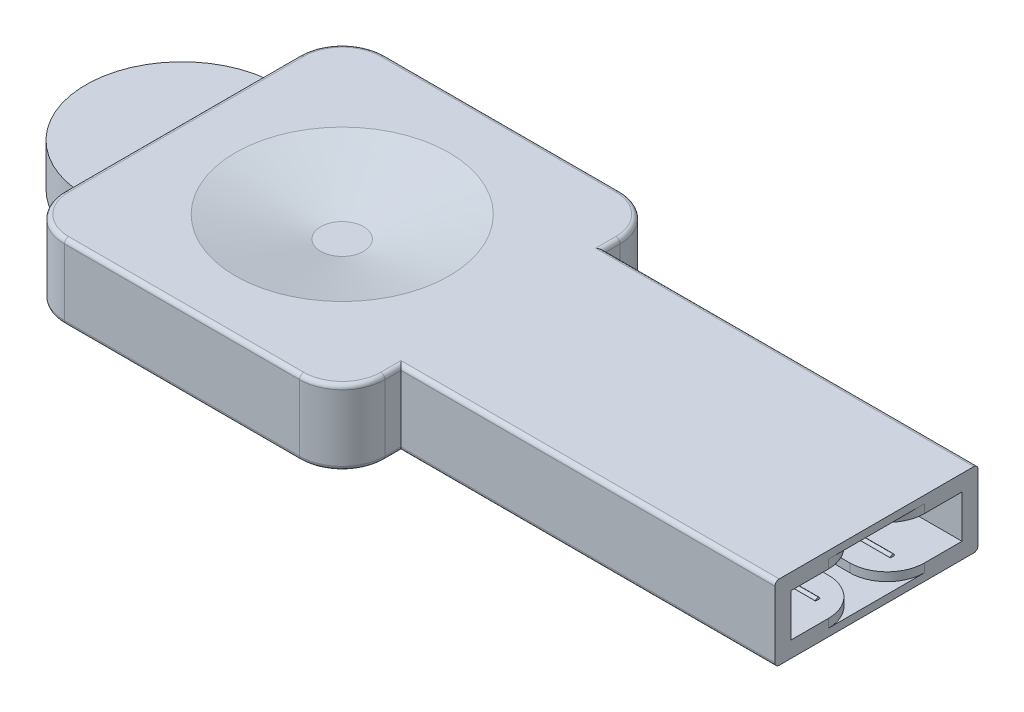
from build123d import *

# Parameters (mm, degrees)
EXTRUDE_1_DEPTH          = 1.75
EXTRUDE_1_DEPTH_BACK     = 1.75
SKETCH_1_W               = 15
SKETCH_1_H               = 15
EXTRUDE_2_DEPTH          = 1
EXTRUDE_2_DEPTH_BACK     = 1
SKETCH_2_R               = 4.5
EXTRUDE_3_DEPTH          = 1.75
EXTRUDE_3_DEPTH_BACK     = 1.75
SKETCH_3_W               = 17.5
SKETCH_3_H               = 9.5
SKETCH_4_R               = 5
SKETCH_5_R               = 1
SKETCH_6_W               = 8
SKETCH_6_H               = 2
CUT_EXTRUDE_1_DEPTH      = 6
SKETCH_7_W               = 1
SKETCH_7_H               = 2.8
CUT_EXTRUDE_2_DEPTH      = 6
SKETCH_8_R               = 0.1
EXTRUDE_4_DEPTH          = 5
MIRROR_3_COPY_1_SKETCH_R = 0.1
MIRROR_3_COPY_1_DEPTH    = 5
FILLET_1_R               = 1.75
FILLET_2_R               = 0.2
FILLET_3_R               = 2


with BuildPart() as part:
    # 草图1 → 凸台-拉伸1 (new, two sides: drawn at the far end of the back side and taken through both)
    with BuildSketch(Plane(origin=(0, 0, 0), x_dir=(1, 0, 0), z_dir=(0, 1, 0)).offset(-EXTRUDE_1_DEPTH_BACK)):
        Rectangle(SKETCH_1_W, SKETCH_1_H)
    extrude(amount=EXTRUDE_1_DEPTH + EXTRUDE_1_DEPTH_BACK)

    # 草图2 → 凸台-拉伸2 (add, two sides: drawn at the far end of the back side and taken through both)
    with BuildSketch(Plane(origin=(0, 0, 0), x_dir=(1, 0, 0), z_dir=(0, 1, 0)).offset(-EXTRUDE_2_DEPTH_BACK)):
        with Locations((-7.5, 0)):
            Circle(SKETCH_2_R)
    extrude(amount=EXTRUDE_2_DEPTH + EXTRUDE_2_DEPTH_BACK)

    # 草图3 → 凸台-拉伸3 (add, two sides: drawn at the far end of the back side and taken through both)
    with BuildSketch(Plane(origin=(0, 0, 0), x_dir=(1, 0, 0), z_dir=(0, 1, 0)).offset(-EXTRUDE_3_DEPTH_BACK)):
        with Locations((16.25, 0)):
            Rectangle(SKETCH_3_W, SKETCH_3_H)
    extrude(amount=EXTRUDE_3_DEPTH + EXTRUDE_3_DEPTH_BACK)

    # 草图4 → 切除-放样1 section 0
    with BuildSketch(Plane(origin=(0, 1.75, 0), x_dir=(1, 0, 0), z_dir=(0, 1, 0))):
        Circle(SKETCH_4_R)
    # 草图5 → 切除-放样1 section 1
    with BuildSketch(Plane(origin=(0, 0.75, 0), x_dir=(1, 0, 0), z_dir=(0, 1, 0))):
        Circle(SKETCH_5_R)
    loft_1 = loft(mode=Mode.SUBTRACT)

    # 镜向1: 切除-放样1 across plane
    add(loft_1.mirror(Plane.ZX), mode=Mode.SUBTRACT)

    # 草图6 → 切除-拉伸1 (cut)
    with BuildSketch(Plane(origin=(25, 0, 0), x_dir=(0, 0, -1), z_dir=(1, 0, 0))):
        Rectangle(SKETCH_6_W, SKETCH_6_H)
    extrude(amount=-CUT_EXTRUDE_1_DEPTH, mode=Mode.SUBTRACT)

    # 草图7 → 切除-拉伸2 (cut)
    with BuildSketch(Plane(origin=(25, 0, 0), x_dir=(0, 0, -1), z_dir=(1, 0, 0))):
        Rectangle(SKETCH_7_W, SKETCH_7_H)
    extrude(amount=-CUT_EXTRUDE_2_DEPTH, mode=Mode.SUBTRACT)

    # 草图8 → 凸台-拉伸4 (add)
    with BuildSketch(Plane(origin=(19, 0, 0), x_dir=(0, 0, -1), z_dir=(1, 0, 0))):
        with Locations((-1.75, -1)):
            Circle(SKETCH_8_R)
    extrude_4 = extrude(amount=EXTRUDE_4_DEPTH)

    # 镜向2: 凸台-拉伸4 across plane
    add(extrude_4.mirror(Plane.XY))

    # 镜向3: 凸台-拉伸4 across plane
    add(extrude_4.mirror(Plane.ZX))

    # 镜向3 copy 1 sketch → 镜向3 copy 1 (add)
    with BuildSketch(Plane(origin=(19, 0, 0), x_dir=(0, 0, 1), z_dir=(1, 0, 0))):
        with Locations((-1.75, -1)):
            Circle(MIRROR_3_COPY_1_SKETCH_R)
    extrude(amount=MIRROR_3_COPY_1_DEPTH)

    # 圆角1
    fillet_1_edges = [part.edges().sort_by_distance(p)[0] for p in [
        (25, 1.2, 0.5),
        (25, 1.2, -0.5),
        (25, -1.2, -0.5),
        (25, -1.2, 0.5),
    ]]
    fillet(fillet_1_edges, radius=FILLET_1_R)

    # 圆角2
    fillet_2_edges = [part.edges().sort_by_distance(p)[0] for p in [
        (-7.5, -1.75, 0),
        (0, -1.75, 7.5),
        (0, -1.75, -7.5),
        (7.5, -1.75, -6.125),
        (7.5, -1.75, 6.125),
        (16.25, 1.75, 4.75),
        (16.25, -1.75, 4.75),
        (16.25, 1.75, -4.75),
        (16.25, -1.75, -4.75),
        (7.5, 1.75, 6.125),
        (7.5, 1.75, -6.125),
        (0, 1.75, -7.5),
        (0, 1.75, 7.5),
        (-7.5, 1.75, 0),
    ]]
    fillet(fillet_2_edges, radius=FILLET_2_R)

    # 圆角3
    # the kernel refuses this fillet: 2 mm, written as the material it takes off along each edge
    with BuildSketch(Plane(origin=(5.5, -1.75, -5.5), x_dir=(0, 0, -1), z_dir=(-1, 0, 0))) as fillet_3_piece_1:
        with BuildLine():
            CenterArc((1.8, -0.2), 0.2, 0, 90)
            Line((2, -0.2), (2, 0))
            Line((2, 0), (1.8, 0))
        make_face()
    revolve(axis=Axis((5.5, -1.75, -5.5), (0, -1, 0)), revolution_arc=90, mode=Mode.SUBTRACT)
    with BuildSketch(Plane(origin=(5.5, -1.75, 5.5), x_dir=(1, 0, 0), z_dir=(0, 0, -1))) as fillet_3_piece_2:
        with BuildLine():
            CenterArc((1.8, -0.2), 0.2, 0, 90)
            Line((2, -0.2), (2, 0))
            Line((2, 0), (1.8, 0))
        make_face()
    revolve(axis=Axis((5.5, -1.75, 5.5), (0, -1, 0)), revolution_arc=90, mode=Mode.SUBTRACT)
    with BuildSketch(Plane(origin=(-5.5, -1.75, -5.5), x_dir=(-1, 0, 0), z_dir=(0, 0, 1))) as fillet_3_piece_3:
        with BuildLine():
            CenterArc((1.8, -0.2), 0.2, 0, 90)
            Line((2, -0.2), (2, 0))
            Line((2, 0), (1.8, 0))
        make_face()
    revolve(axis=Axis((-5.5, -1.75, -5.5), (0, -1, 0)), revolution_arc=90, mode=Mode.SUBTRACT)
    with BuildSketch(Plane(origin=(-5.5, -1.75, 5.5), x_dir=(0, 0, 1), z_dir=(1, 0, 0))) as fillet_3_piece_4:
        with BuildLine():
            CenterArc((1.8, -0.2), 0.2, 0, 90)
            Line((2, -0.2), (2, 0))
            Line((2, 0), (1.8, 0))
        make_face()
    revolve(axis=Axis((-5.5, -1.75, 5.5), (0, -1, 0)), revolution_arc=90, mode=Mode.SUBTRACT)
    with BuildSketch(Plane(origin=(5.5, 1.75, -5.5), x_dir=(1, 0, 0), z_dir=(0, 0, 1))) as fillet_3_piece_5:
        with BuildLine():
            CenterArc((1.8, -0.2), 0.2, 0, 90)
            Line((2, -0.2), (2, 0))
            Line((2, 0), (1.8, 0))
        make_face()
    revolve(axis=Axis((5.5, 1.75, -5.5), (0, 1, 0)), revolution_arc=90, mode=Mode.SUBTRACT)
    with BuildSketch(Plane(origin=(-5.5, 1.75, -5.5), x_dir=(0, 0, -1), z_dir=(1, 0, 0))) as fillet_3_piece_6:
        with BuildLine():
            CenterArc((1.8, -0.2), 0.2, 0, 90)
            Line((2, -0.2), (2, 0))
            Line((2, 0), (1.8, 0))
        make_face()
    revolve(axis=Axis((-5.5, 1.75, -5.5), (0, 1, 0)), revolution_arc=90, mode=Mode.SUBTRACT)
    with BuildSketch(Plane(origin=(-5.5, 1.75, 5.5), x_dir=(-1, 0, 0), z_dir=(0, 0, -1))) as fillet_3_piece_7:
        with BuildLine():
            CenterArc((1.8, -0.2), 0.2, 0, 90)
            Line((2, -0.2), (2, 0))
            Line((2, 0), (1.8, 0))
        make_face()
    revolve(axis=Axis((-5.5, 1.75, 5.5), (0, 1, 0)), revolution_arc=90, mode=Mode.SUBTRACT)
    with BuildSketch(Plane(origin=(5.5, 1.75, 5.5), x_dir=(0, 0, 1), z_dir=(-1, 0, 0))) as fillet_3_piece_8:
        with BuildLine():
            CenterArc((1.8, -0.2), 0.2, 0, 90)
            Line((2, -0.2), (2, 0))
            Line((2, 0), (1.8, 0))
        make_face()
    revolve(axis=Axis((5.5, 1.75, 5.5), (0, 1, 0)), revolution_arc=90, mode=Mode.SUBTRACT)
    with BuildSketch(Plane(origin=(-7.5, 1.75, 7.5), x_dir=(1, 0, 0), z_dir=(0, -1, 0)), Plane(origin=(-7.5, -1.75, -7.5), x_dir=(1, 0, 0), z_dir=(0, 1, 0)), Plane(origin=(7.5, 1.75, 7.5), x_dir=(0, 0, -1), z_dir=(0, -1, 0)), Plane(origin=(7.5, -1.75, -7.5), x_dir=(0, 0, 1), z_dir=(0, 1, 0))) as fillet_3_piece_9:
        with BuildLine():
            CenterArc((FILLET_3_R, -FILLET_3_R), FILLET_3_R, 90, 90)
            Line((0, -FILLET_3_R), (0, 0))
            Line((0, 0), (FILLET_3_R, 0))
        make_face()
    extrude(amount=3.5, mode=Mode.SUBTRACT)


solid = part.part
